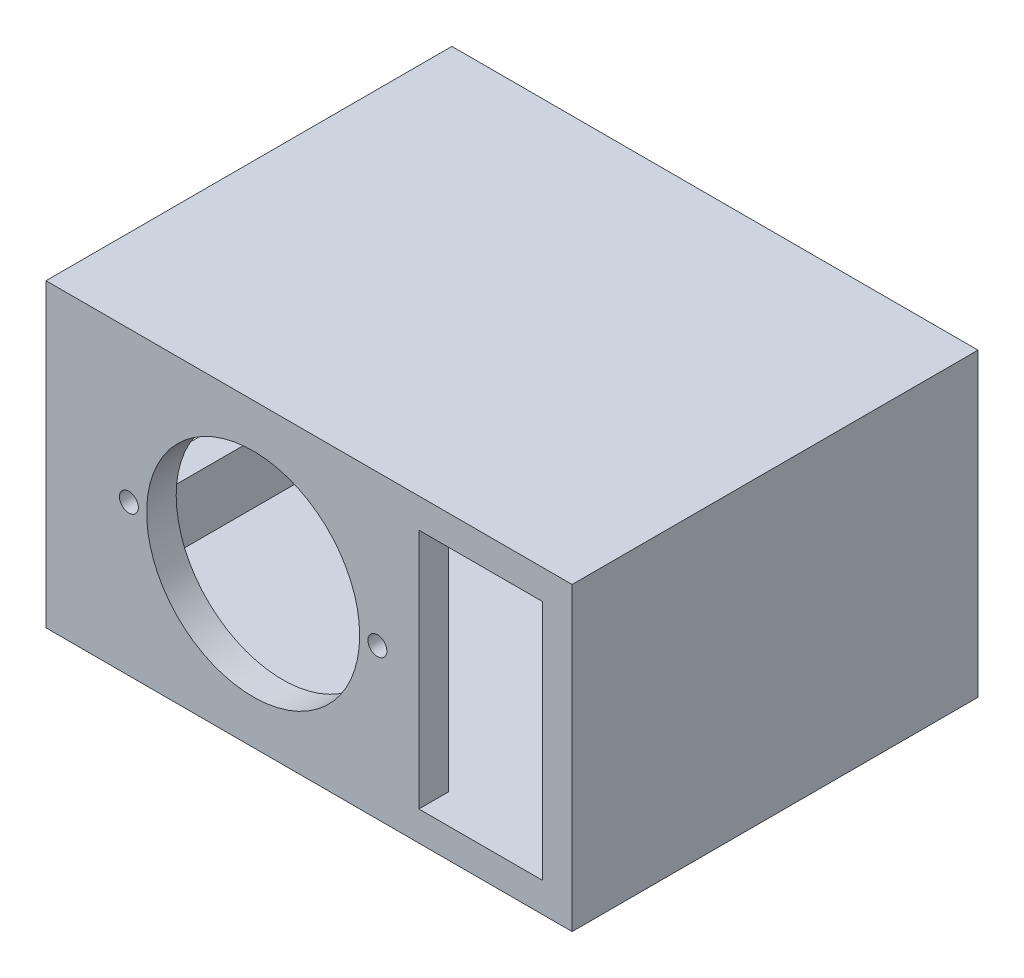
from build123d import *

# Parameters (mm, degrees)
SKETCH1_W           = 88.9
SKETCH1_H           = 50.8
BOSS_EXTRUDE1_DEPTH = 68.58
SHELL5_START        = 5
SHELL5_OUTLINE_W    = 40.8
SHELL5_OUTLINE_H    = 58.58
SHELL5_DEPTH        = 78.9
SKETCH2_R           = 18
SKETCH2_R_2         = 1.6
SKETCH2_W           = 20.9
SKETCH2_H           = 40.8
CUT_EXTRUDE2_DEPTH  = 68.58
SKETCH7_W           = 38.58
SKETCH7_H           = 20.8
CUT_EXTRUDE6_DEPTH  = 10


# Read off the part's stored shape, not the designer's step: Shell5
with BuildPart() as part:
    # Sketch1 → Boss-Extrude1 (new body)
    with BuildSketch(Plane.XY):
        with Locations((44.45, 25.4)):
            Rectangle(SKETCH1_W, SKETCH1_H)
    extrude(amount=BOSS_EXTRUDE1_DEPTH)

    # Shell5 outline → Shell5 (cut)
    with BuildSketch(Plane.YZ.offset(SHELL5_START)):
        with Locations((25.4, 34.29)):
            Rectangle(SHELL5_OUTLINE_W, SHELL5_OUTLINE_H)
    extrude(amount=SHELL5_DEPTH, mode=Mode.SUBTRACT)

    # Sketch2 → Cut-Extrude2 (cut)
    with BuildSketch(Plane.XY.offset(68.58)):
        with Locations((35, 25.4)):
            Circle(SKETCH2_R)
        with Locations((14, 25.4)):
            Circle(SKETCH2_R_2)
        with Locations((56, 25.4)):
            Circle(SKETCH2_R_2)
        with Locations((73.45, 25.4)):
            Rectangle(SKETCH2_W, SKETCH2_H)
    extrude(amount=-CUT_EXTRUDE2_DEPTH, mode=Mode.SUBTRACT)

    # Sketch7 → Cut-Extrude6 (cut)
    with BuildSketch(Plane.ZY):
        with Locations((34.29, 25.4)):
            Rectangle(SKETCH7_W, SKETCH7_H)
    extrude(amount=-CUT_EXTRUDE6_DEPTH, mode=Mode.SUBTRACT)


solid = part.part
